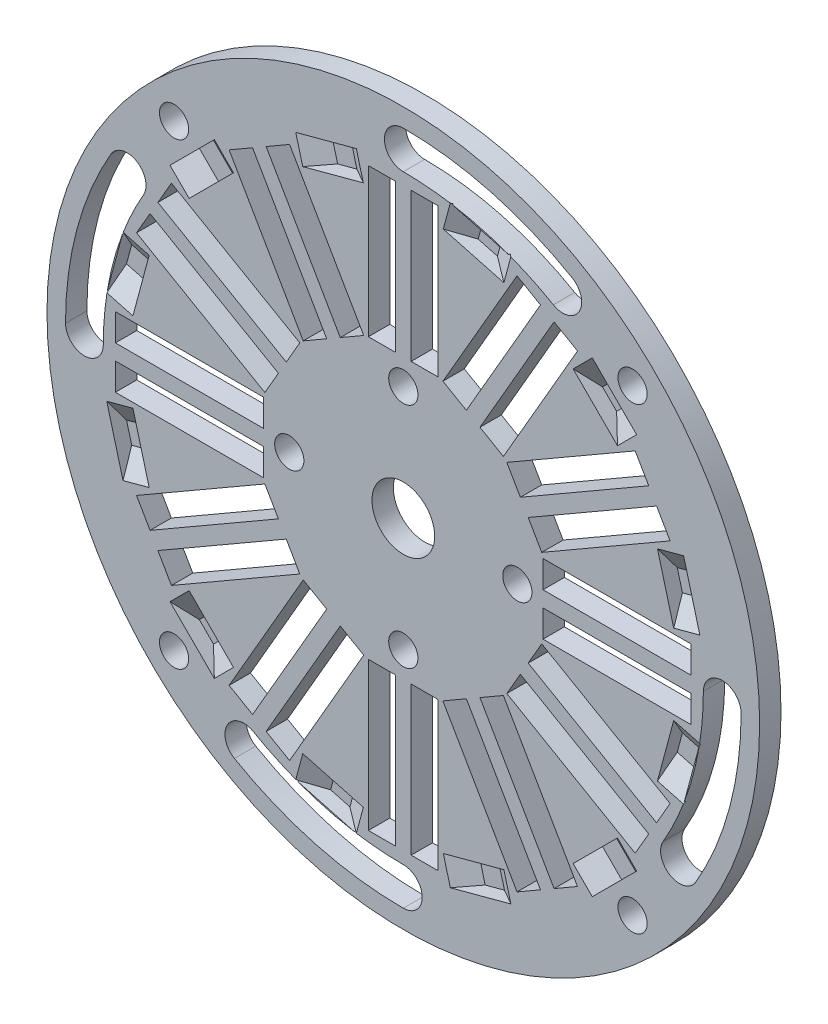
from build123d import *
from OCP.BRepFilletAPI import BRepFilletAPI_MakeChamfer

# Parameters (mm, degrees)
CROQUIS1_R              = 50
SALIENTE_EXTRUIR1_DEPTH = 3
CROQUIS2_W              = 9.8
CROQUIS2_H              = 20.8
CROQUIS2_W_2            = 20.8
CROQUIS2_H_2            = 9.8
CORTAR_EXTRUIR1_DEPTH   = 71.774289117
CROQUIS3_W              = 2.2
CROQUIS3_H              = 20.8
CROQUIS3_W_2            = 20.8
CROQUIS3_H_2            = 2.2
SALIENTE_EXTRUIR2_DEPTH = 3
CROQUIS5_R              = 4.4
CROQUIS5_R_2            = 2.65
CORTAR_EXTRUIR3_DEPTH   = 10
CORTAR_EXTRUIR4_DEPTH   = 2
CHAFL_N3_SIZE           = 2
CHAFL_N3_SIZE_2         = 3
CHAFL_N4_SIZE           = 2
CHAFL_N4_SIZE_2         = 3
CORTAR_EXTRUIR5_DEPTH   = 10
CROQUIS8_R              = 2.05
CORTAR_EXTRUIR6_DEPTH   = 71.774289117
CROQUIS9_R              = 2.05
CORTAR_EXTRUIR7_DEPTH   = 71.774289117


with BuildPart() as part:
    # Croquis1 → Saliente-Extruir1 (new body)
    with BuildSketch(Plane(origin=(0, 0, 0), x_dir=(0, 1, 0), z_dir=(0, 0, 1))):
        with Locations(Location((0, 0, 0), (0, 0, 270))):
            Circle(CROQUIS1_R)
    extrude(amount=SALIENTE_EXTRUIR1_DEPTH)

    # Croquis2 → Cortar-Extruir1 (cut, through all)
    with BuildSketch(Plane.XY.offset(3)):
        Polygon((15.956475521, 37.437426313), (5.556475521, 19.424097914), (14.043524479, 14.524097914), (24.443524479, 32.537426313), align=None)
        with Locations((0, 30)):
            Rectangle(CROQUIS2_W, CROQUIS2_H)
        Polygon((32.537426313, 24.443524479), (14.524097914, 14.043524479), (19.424097914, 5.556475521), (37.437426313, 15.956475521), align=None)
        with Locations((30, 0)):
            Rectangle(CROQUIS2_W_2, CROQUIS2_H_2)
        Polygon((37.437426313, -15.956475521), (19.424097914, -5.556475521), (14.524097914, -14.043524479), (32.537426313, -24.443524479), align=None)
        Polygon((24.443524479, -32.537426313), (14.043524479, -14.524097914), (5.556475521, -19.424097914), (15.956475521, -37.437426313), align=None)
        with Locations((0, -30)):
            Rectangle(CROQUIS2_W, CROQUIS2_H)
        Polygon((-15.956475521, -37.437426313), (-5.556475521, -19.424097914), (-14.043524479, -14.524097914), (-24.443524479, -32.537426313), align=None)
        Polygon((-32.537426313, -24.443524479), (-14.524097914, -14.043524479), (-19.424097914, -5.556475521), (-37.437426313, -15.956475521), align=None)
        with Locations((-30, 0)):
            Rectangle(CROQUIS2_W_2, CROQUIS2_H_2)
        Polygon((-37.437426313, 15.956475521), (-19.424097914, 5.556475521), (-14.524097914, 14.043524479), (-32.537426313, 24.443524479), align=None)
        Polygon((-24.443524479, 32.537426313), (-14.043524479, 14.524097914), (-5.556475521, 19.424097914), (-15.956475521, 37.437426313), align=None)
    extrude(amount=-CORTAR_EXTRUIR1_DEPTH, mode=Mode.SUBTRACT)

    # Croquis3 → Saliente-Extruir2 (add)
    with BuildSketch(Plane.XY.offset(3)):
        Polygon((19.247372056, 35.537426313), (8.847372056, 17.524097914), (10.752627944, 16.424097914), (21.152627944, 34.437426313), align=None)
        with Locations((0, 30)):
            Rectangle(CROQUIS3_W, CROQUIS3_H)
        Polygon((34.437426313, 21.152627944), (16.424097914, 10.752627944), (17.524097914, 8.847372056), (35.537426313, 19.247372056), align=None)
        with Locations((30, 0)):
            Rectangle(CROQUIS3_W_2, CROQUIS3_H_2)
        Polygon((35.537426313, -19.247372056), (17.524097914, -8.847372056), (16.424097914, -10.752627944), (34.437426313, -21.152627944), align=None)
        Polygon((21.152627944, -34.437426313), (10.752627944, -16.424097914), (8.847372056, -17.524097914), (19.247372056, -35.537426313), align=None)
        with Locations((0, -30)):
            Rectangle(CROQUIS3_W, CROQUIS3_H)
        Polygon((-19.247372056, -35.537426313), (-8.847372056, -17.524097914), (-10.752627944, -16.424097914), (-21.152627944, -34.437426313), align=None)
        Polygon((-34.437426313, -21.152627944), (-16.424097914, -10.752627944), (-17.524097914, -8.847372056), (-35.537426313, -19.247372056), align=None)
        with Locations((-30, 0)):
            Rectangle(CROQUIS3_W_2, CROQUIS3_H_2)
        Polygon((-35.537426313, 19.247372056), (-17.524097914, 8.847372056), (-16.424097914, 10.752627944), (-34.437426313, 21.152627944), align=None)
        Polygon((-21.152627944, 34.437426313), (-10.752627944, 16.424097914), (-8.847372056, 17.524097914), (-19.247372056, 35.537426313), align=None)
    extrude(amount=-SALIENTE_EXTRUIR2_DEPTH)

    # Croquis5 → Cortar-Extruir3 (cut)
    with BuildSketch(Plane.XY.offset(3)):
        Circle(CROQUIS5_R)
        with Locations((0, 44.75)):
            Circle(CROQUIS5_R_2)
        with Locations((44.75, 0)):
            Circle(CROQUIS5_R_2)
        with Locations((0, -44.75)):
            Circle(CROQUIS5_R_2)
        with Locations((-44.75, 0)):
            Circle(CROQUIS5_R_2)
    extrude(amount=-CORTAR_EXTRUIR3_DEPTH, mode=Mode.SUBTRACT)

    # Croquis6 → Cortar-Extruir4 (cut)
    with BuildSketch(Plane.XY.offset(3)):
        Polygon((26.516504294, 32.739043969), (32.739043969, 26.516504294), (30.0520382, 23.829498526), (23.829498526, 30.0520382), align=None)
        Polygon((39.333488323, 15.094591625), (35.662970183, 14.111079254), (37.94057778, 5.610931983), (41.61109592, 6.594444354), align=None)
        Polygon((41.61109592, -6.594444354), (37.94057778, -5.610931983), (35.662970183, -14.111079254), (39.333488323, -15.094591625), align=None)
        Polygon((32.739043969, -26.516504294), (30.0520382, -23.829498526), (23.829498526, -30.0520382), (26.516504295, -32.739043969), align=None)
        Polygon((15.094591625, -39.333488323), (14.111079254, -35.662970183), (5.610931983, -37.94057778), (6.594444354, -41.61109592), align=None)
        Polygon((-6.594444354, -41.61109592), (-5.610931983, -37.94057778), (-14.111079254, -35.662970183), (-15.094591625, -39.333488323), align=None)
        Polygon((-26.516504294, -32.739043969), (-23.829498526, -30.0520382), (-30.0520382, -23.829498526), (-32.739043969, -26.516504294), align=None)
        Polygon((-39.333488323, -15.094591625), (-35.662970183, -14.111079254), (-37.94057778, -5.610931983), (-41.61109592, -6.594444354), align=None)
        Polygon((-41.61109592, 6.594444354), (-37.94057778, 5.610931983), (-35.662970183, 14.111079254), (-39.333488323, 15.094591625), align=None)
        Polygon((-32.739043969, 26.516504294), (-30.0520382, 23.829498526), (-23.829498526, 30.0520382), (-26.516504294, 32.739043969), align=None)
        Polygon((-15.094591625, 39.333488323), (-14.111079254, 35.662970183), (-5.610931983, 37.94057778), (-6.594444354, 41.61109592), align=None)
        Polygon((6.594444354, 41.61109592), (5.610931983, 37.94057778), (14.111079254, 35.662970183), (15.094591625, 39.333488323), align=None)
    extrude(amount=-CORTAR_EXTRUIR4_DEPTH, mode=Mode.SUBTRACT)

    # Chaflán3
    chafl_n3_edges_1 = [part.edges().sort_by_distance(p)[0] for p in [
        (6.102688168, 39.77583685, 1),
    ]]
    chafl_n3_side_1 = [part.faces().sort_by_distance(p)[0] for p in [
        (6.102688168, 39.77583685, 1.04),
    ]]
    chafl_n3_edges_2 = [part.edges().sort_by_distance(p)[0] for p in [
        (25.17300141, 31.395541085, 1),
    ]]
    chafl_n3_side_2 = [part.faces().sort_by_distance(p)[0] for p in [
        (25.17300141, 31.395541085, 1.04),
    ]]
    chafl_n3_edges_3 = [part.edges().sort_by_distance(p)[0] for p in [
        (37.498229253, 14.60283544, 1),
    ]]
    chafl_n3_side_3 = [part.faces().sort_by_distance(p)[0] for p in [
        (37.498229253, 14.60283544, 1.04),
    ]]
    chafl_n3_edges_4 = [part.edges().sort_by_distance(p)[0] for p in [
        (39.77583685, -6.102688168, 1),
    ]]
    chafl_n3_side_4 = [part.faces().sort_by_distance(p)[0] for p in [
        (39.77583685, -6.102688168, 1.04),
    ]]
    chafl_n3_edges_5 = [part.edges().sort_by_distance(p)[0] for p in [
        (31.395541085, -25.17300141, 1),
    ]]
    chafl_n3_side_5 = [part.faces().sort_by_distance(p)[0] for p in [
        (31.395541085, -25.17300141, 1.04),
    ]]
    chafl_n3_edges_6 = [part.edges().sort_by_distance(p)[0] for p in [
        (14.60283544, -37.498229253, 1),
    ]]
    chafl_n3_side_6 = [part.faces().sort_by_distance(p)[0] for p in [
        (14.60283544, -37.498229253, 1.04),
    ]]
    chafl_n3_edges_7 = [part.edges().sort_by_distance(p)[0] for p in [
        (-6.102688168, -39.77583685, 1),
    ]]
    chafl_n3_side_7 = [part.faces().sort_by_distance(p)[0] for p in [
        (-6.102688168, -39.77583685, 1.04),
    ]]
    chafl_n3_edges_8 = [part.edges().sort_by_distance(p)[0] for p in [
        (-25.17300141, -31.395541085, 1),
    ]]
    chafl_n3_side_8 = [part.faces().sort_by_distance(p)[0] for p in [
        (-25.17300141, -31.395541085, 1.04),
    ]]
    chafl_n3_edges_9 = [part.edges().sort_by_distance(p)[0] for p in [
        (-37.498229253, -14.60283544, 1),
    ]]
    chafl_n3_side_9 = [part.faces().sort_by_distance(p)[0] for p in [
        (-37.498229253, -14.60283544, 1.04),
    ]]
    chafl_n3_edges_10 = [part.edges().sort_by_distance(p)[0] for p in [
        (-14.60283544, 37.498229253, 1),
    ]]
    chafl_n3_side_10 = [part.faces().sort_by_distance(p)[0] for p in [
        (-14.60283544, 37.498229253, 1.04),
    ]]
    chafl_n3_edges_11 = [part.edges().sort_by_distance(p)[0] for p in [
        (-31.395541085, 25.17300141, 1),
    ]]
    chafl_n3_side_11 = [part.faces().sort_by_distance(p)[0] for p in [
        (-31.395541085, 25.17300141, 1.04),
    ]]
    chafl_n3_edges_12 = [part.edges().sort_by_distance(p)[0] for p in [
        (-39.77583685, 6.102688168, 1),
    ]]
    chafl_n3_side_12 = [part.faces().sort_by_distance(p)[0] for p in [
        (-39.77583685, 6.102688168, 1.04),
    ]]
    chafl_n3 = BRepFilletAPI_MakeChamfer(part.part.solid().wrapped)
    for e in chafl_n3_edges_1:
        chafl_n3.Add(CHAFL_N3_SIZE - 0.0001, CHAFL_N3_SIZE_2 - 0.0001, e.wrapped, chafl_n3_side_1[0].wrapped)
    for e in chafl_n3_edges_2:
        chafl_n3.Add(CHAFL_N3_SIZE - 0.0001, CHAFL_N3_SIZE_2 - 0.0001, e.wrapped, chafl_n3_side_2[0].wrapped)
    for e in chafl_n3_edges_3:
        chafl_n3.Add(CHAFL_N3_SIZE - 0.0001, CHAFL_N3_SIZE_2 - 0.0001, e.wrapped, chafl_n3_side_3[0].wrapped)
    for e in chafl_n3_edges_4:
        chafl_n3.Add(CHAFL_N3_SIZE - 0.0001, CHAFL_N3_SIZE_2 - 0.0001, e.wrapped, chafl_n3_side_4[0].wrapped)
    for e in chafl_n3_edges_5:
        chafl_n3.Add(CHAFL_N3_SIZE - 0.0001, CHAFL_N3_SIZE_2 - 0.0001, e.wrapped, chafl_n3_side_5[0].wrapped)
    for e in chafl_n3_edges_6:
        chafl_n3.Add(CHAFL_N3_SIZE - 0.0001, CHAFL_N3_SIZE_2 - 0.0001, e.wrapped, chafl_n3_side_6[0].wrapped)
    for e in chafl_n3_edges_7:
        chafl_n3.Add(CHAFL_N3_SIZE - 0.0001, CHAFL_N3_SIZE_2 - 0.0001, e.wrapped, chafl_n3_side_7[0].wrapped)
    for e in chafl_n3_edges_8:
        chafl_n3.Add(CHAFL_N3_SIZE - 0.0001, CHAFL_N3_SIZE_2 - 0.0001, e.wrapped, chafl_n3_side_8[0].wrapped)
    for e in chafl_n3_edges_9:
        chafl_n3.Add(CHAFL_N3_SIZE - 0.0001, CHAFL_N3_SIZE_2 - 0.0001, e.wrapped, chafl_n3_side_9[0].wrapped)
    for e in chafl_n3_edges_10:
        chafl_n3.Add(CHAFL_N3_SIZE - 0.0001, CHAFL_N3_SIZE_2 - 0.0001, e.wrapped, chafl_n3_side_10[0].wrapped)
    for e in chafl_n3_edges_11:
        chafl_n3.Add(CHAFL_N3_SIZE - 0.0001, CHAFL_N3_SIZE_2 - 0.0001, e.wrapped, chafl_n3_side_11[0].wrapped)
    for e in chafl_n3_edges_12:
        chafl_n3.Add(CHAFL_N3_SIZE - 0.0001, CHAFL_N3_SIZE_2 - 0.0001, e.wrapped, chafl_n3_side_12[0].wrapped)
    add(Compound.cast(chafl_n3.Shape()), mode=Mode.REPLACE)  # a hair under: the kernel refuses the full size

    # Chaflán4
    chafl_n4_edges_1 = [part.edges().sort_by_distance(p)[0] for p in [
        (6.102688168, -39.77583685, 1),
    ]]
    chafl_n4_side_1 = [part.faces().sort_by_distance(p)[0] for p in [
        (6.102688168, -39.77583685, 1.04),
    ]]
    chafl_n4_edges_2 = [part.edges().sort_by_distance(p)[0] for p in [
        (25.17300141, -31.395541085, 1),
    ]]
    chafl_n4_side_2 = [part.faces().sort_by_distance(p)[0] for p in [
        (25.201285681, -31.367256813, 1),
    ]]
    chafl_n4_edges_3 = [part.edges().sort_by_distance(p)[0] for p in [
        (37.498229253, -14.60283544, 1),
    ]]
    chafl_n4_side_3 = [part.faces().sort_by_distance(p)[0] for p in [
        (37.498229253, -14.60283544, 1.04),
    ]]
    chafl_n4_edges_4 = [part.edges().sort_by_distance(p)[0] for p in [
        (39.77583685, 6.102688168, 1),
    ]]
    chafl_n4_side_4 = [part.faces().sort_by_distance(p)[0] for p in [
        (39.77583685, 6.102688168, 1.04),
    ]]
    chafl_n4_edges_5 = [part.edges().sort_by_distance(p)[0] for p in [
        (31.395541085, 25.17300141, 1),
    ]]
    chafl_n4_side_5 = [part.faces().sort_by_distance(p)[0] for p in [
        (31.395541085, 25.17300141, 1.04),
    ]]
    chafl_n4_edges_6 = [part.edges().sort_by_distance(p)[0] for p in [
        (14.60283544, 37.498229253, 1),
    ]]
    chafl_n4_side_6 = [part.faces().sort_by_distance(p)[0] for p in [
        (14.60283544, 37.498229253, 1.04),
    ]]
    chafl_n4_edges_7 = [part.edges().sort_by_distance(p)[0] for p in [
        (-6.102688168, 39.77583685, 1),
    ]]
    chafl_n4_side_7 = [part.faces().sort_by_distance(p)[0] for p in [
        (-6.102688168, 39.77583685, 1.04),
    ]]
    chafl_n4_edges_8 = [part.edges().sort_by_distance(p)[0] for p in [
        (-25.17300141, 31.395541085, 1),
    ]]
    chafl_n4_side_8 = [part.faces().sort_by_distance(p)[0] for p in [
        (-25.17300141, 31.395541085, 1.04),
    ]]
    chafl_n4_edges_9 = [part.edges().sort_by_distance(p)[0] for p in [
        (-37.498229253, 14.60283544, 1),
    ]]
    chafl_n4_side_9 = [part.faces().sort_by_distance(p)[0] for p in [
        (-37.498229253, 14.60283544, 1.04),
    ]]
    chafl_n4_edges_10 = [part.edges().sort_by_distance(p)[0] for p in [
        (-14.60283544, -37.498229253, 1),
    ]]
    chafl_n4_side_10 = [part.faces().sort_by_distance(p)[0] for p in [
        (-14.60283544, -37.498229253, 1.04),
    ]]
    chafl_n4_edges_11 = [part.edges().sort_by_distance(p)[0] for p in [
        (-39.77583685, -6.102688168, 1),
    ]]
    chafl_n4_side_11 = [part.faces().sort_by_distance(p)[0] for p in [
        (-39.77583685, -6.102688168, 1.04),
    ]]
    chafl_n4_edges_12 = [part.edges().sort_by_distance(p)[0] for p in [
        (-31.395541085, -25.17300141, 1),
    ]]
    chafl_n4_side_12 = [part.faces().sort_by_distance(p)[0] for p in [
        (-31.395541085, -25.17300141, 1.04),
    ]]
    chafl_n4 = BRepFilletAPI_MakeChamfer(part.part.solid().wrapped)
    for e in chafl_n4_edges_1:
        chafl_n4.Add(CHAFL_N4_SIZE - 0.0001, CHAFL_N4_SIZE_2 - 0.0001, e.wrapped, chafl_n4_side_1[0].wrapped)
    for e in chafl_n4_edges_2:
        chafl_n4.Add(CHAFL_N4_SIZE_2 - 0.0001, CHAFL_N4_SIZE - 0.0001, e.wrapped, chafl_n4_side_2[0].wrapped)
    for e in chafl_n4_edges_3:
        chafl_n4.Add(CHAFL_N4_SIZE - 0.0001, CHAFL_N4_SIZE_2 - 0.0001, e.wrapped, chafl_n4_side_3[0].wrapped)
    for e in chafl_n4_edges_4:
        chafl_n4.Add(CHAFL_N4_SIZE - 0.0001, CHAFL_N4_SIZE_2 - 0.0001, e.wrapped, chafl_n4_side_4[0].wrapped)
    for e in chafl_n4_edges_5:
        chafl_n4.Add(CHAFL_N4_SIZE - 0.0001, CHAFL_N4_SIZE_2 - 0.0001, e.wrapped, chafl_n4_side_5[0].wrapped)
    for e in chafl_n4_edges_6:
        chafl_n4.Add(CHAFL_N4_SIZE - 0.0001, CHAFL_N4_SIZE_2 - 0.0001, e.wrapped, chafl_n4_side_6[0].wrapped)
    for e in chafl_n4_edges_7:
        chafl_n4.Add(CHAFL_N4_SIZE - 0.0001, CHAFL_N4_SIZE_2 - 0.0001, e.wrapped, chafl_n4_side_7[0].wrapped)
    for e in chafl_n4_edges_8:
        chafl_n4.Add(CHAFL_N4_SIZE - 0.0001, CHAFL_N4_SIZE_2 - 0.0001, e.wrapped, chafl_n4_side_8[0].wrapped)
    for e in chafl_n4_edges_9:
        chafl_n4.Add(CHAFL_N4_SIZE - 0.0001, CHAFL_N4_SIZE_2 - 0.0001, e.wrapped, chafl_n4_side_9[0].wrapped)
    for e in chafl_n4_edges_10:
        chafl_n4.Add(CHAFL_N4_SIZE - 0.0001, CHAFL_N4_SIZE_2 - 0.0001, e.wrapped, chafl_n4_side_10[0].wrapped)
    for e in chafl_n4_edges_11:
        chafl_n4.Add(CHAFL_N4_SIZE - 0.0001, CHAFL_N4_SIZE_2 - 0.0001, e.wrapped, chafl_n4_side_11[0].wrapped)
    for e in chafl_n4_edges_12:
        chafl_n4.Add(CHAFL_N4_SIZE - 0.0001, CHAFL_N4_SIZE_2 - 0.0001, e.wrapped, chafl_n4_side_12[0].wrapped)
    add(Compound.cast(chafl_n4.Shape()), mode=Mode.REPLACE)  # a hair under: the kernel refuses the full size

    # Croquis7 → Cortar-Extruir5 (cut)
    with BuildSketch(Plane.XY.offset(3)):
        with BuildLine():
            ThreePointArc((0, 47.4), (-2.65, 44.75), (0, 42.1))
            ThreePointArc((0, 42.1), (10.896281799, 40.665477287), (21.05, 36.459669499))
            ThreePointArc((21.05, 36.459669499), (24.66996732, 37.429636819), (23.7, 41.049604139))
            ThreePointArc((23.7, 41.049604139), (12.268022738, 45.784884166), (0, 47.4))
        make_face()
        with BuildLine():
            ThreePointArc((47.4, 0), (44.75, 2.65), (42.1, 0))
            ThreePointArc((42.1, 0), (40.665477287, -10.896281799), (36.459669499, -21.05))
            ThreePointArc((36.459669499, -21.05), (37.429636819, -24.66996732), (41.049604139, -23.7))
            ThreePointArc((41.049604139, -23.7), (45.784884166, -12.268022738), (47.4, 0))
        make_face()
        with BuildLine():
            ThreePointArc((0, -47.4), (2.65, -44.75), (0, -42.1))
            ThreePointArc((0, -42.1), (-10.896281799, -40.665477287), (-21.05, -36.459669499))
            ThreePointArc((-21.05, -36.459669499), (-24.66996732, -37.429636819), (-23.7, -41.049604139))
            ThreePointArc((-23.7, -41.049604139), (-12.268022738, -45.784884166), (0, -47.4))
        make_face()
        with BuildLine():
            ThreePointArc((-47.4, 0), (-44.75, -2.65), (-42.1, 0))
            ThreePointArc((-42.1, 0), (-40.665477287, 10.896281799), (-36.459669499, 21.05))
            ThreePointArc((-36.459669499, 21.05), (-37.429636819, 24.66996732), (-41.049604139, 23.7))
            ThreePointArc((-41.049604139, 23.7), (-45.784884166, 12.268022738), (-47.4, 0))
        make_face()
    extrude(amount=-CORTAR_EXTRUIR5_DEPTH, mode=Mode.SUBTRACT)

    # Croquis8 → Cortar-Extruir6 (cut, through all)
    with BuildSketch(Plane.XY.offset(3)):
        with Locations((0, 16)):
            Circle(CROQUIS8_R)
        with Locations((16, 0)):
            Circle(CROQUIS8_R)
        with Locations((0, -16)):
            Circle(CROQUIS8_R)
        with Locations((-16, 0)):
            Circle(CROQUIS8_R)
    extrude(amount=-CORTAR_EXTRUIR6_DEPTH, mode=Mode.SUBTRACT)

    # Croquis9 → Cortar-Extruir7 (cut, through all)
    with BuildSketch(Plane.XY.offset(3)):
        with Locations((-32.17, 32.17)):
            Circle(CROQUIS9_R)
        with Locations((32.17, 32.17)):
            Circle(CROQUIS9_R)
        with Locations((32.17, -32.17)):
            Circle(CROQUIS9_R)
        with Locations((-32.17, -32.17)):
            Circle(CROQUIS9_R)
    extrude(amount=-CORTAR_EXTRUIR7_DEPTH, mode=Mode.SUBTRACT)


solid = part.part
